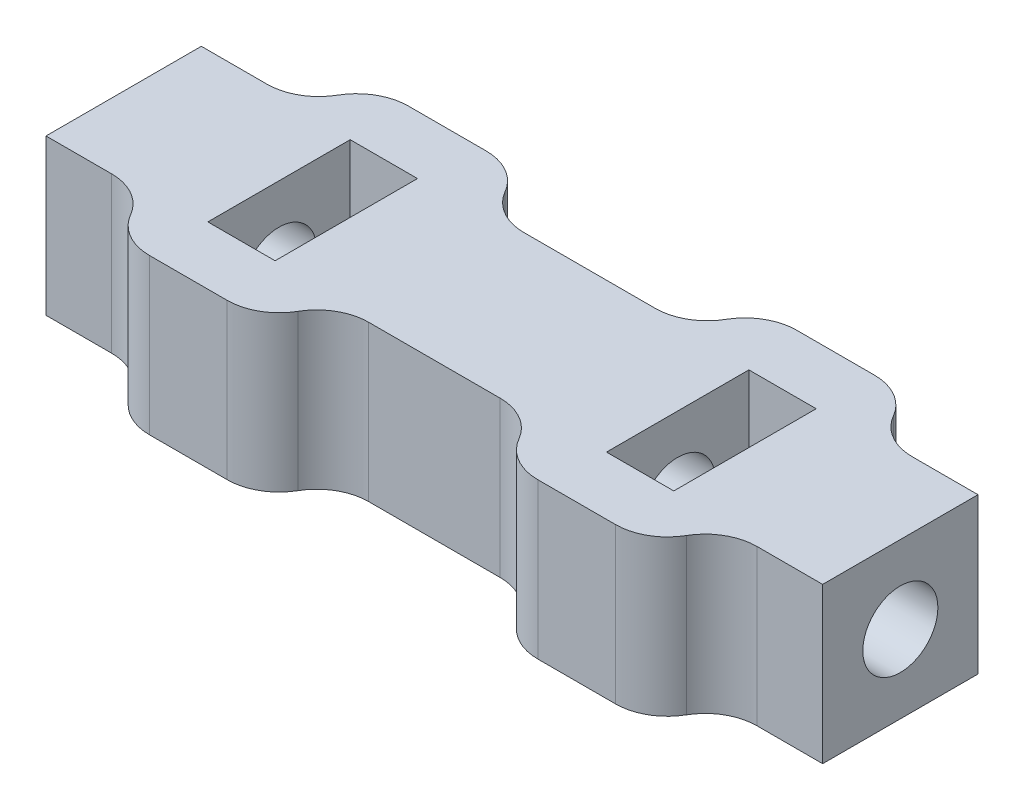
from build123d import *

# Parameters (mm, degrees)
SKETCH1_W           = 30
SKETCH1_H           = 6
BOSS_EXTRUDE1_DEPTH = 6
SKETCH2_R           = 1.45
CUT_EXTRUDE1_DEPTH  = 32.176914536
SKETCH3_W           = 2.6
SKETCH3_H           = 5.5
CUT_EXTRUDE2_DEPTH  = 32.176914536
SKETCH4_W           = 7
SKETCH4_H           = 2
BOSS_EXTRUDE2_DEPTH = 6
FILLET1_R           = 2
FILLET2_R           = 2


with BuildPart() as part:
    # Sketch1 → Boss-Extrude1 (new body)
    with BuildSketch(Plane.XY):
        with Locations((15, -3)):
            Rectangle(SKETCH1_W, SKETCH1_H)
    extrude(amount=BOSS_EXTRUDE1_DEPTH)

    # Sketch2 → Cut-Extrude1 (cut, through all)
    with BuildSketch(Plane(origin=(30, 0, 0), x_dir=(0, 0, -1), z_dir=(1, 0, 0))):
        with Locations((-3, -3)):
            Circle(SKETCH2_R)
    extrude(amount=-CUT_EXTRUDE1_DEPTH, mode=Mode.SUBTRACT)

    # Sketch3 → Cut-Extrude2 (cut, through all)
    with BuildSketch(Plane(origin=(0, 0, 0), x_dir=(1, 0, 0), z_dir=(0, 1, 0))):
        with Locations((7.3, -3)):
            Rectangle(SKETCH3_W, SKETCH3_H)
        with Locations((22.7, -3)):
            Rectangle(SKETCH3_W, SKETCH3_H)
    extrude(amount=-CUT_EXTRUDE2_DEPTH, mode=Mode.SUBTRACT)

    # Sketch4 → Boss-Extrude2 (add)
    with BuildSketch(Plane(origin=(0, 0, 0), x_dir=(1, 0, 0), z_dir=(0, 1, 0))):
        with Locations((7.5, -7)):
            Rectangle(SKETCH4_W, SKETCH4_H)
        with Locations((22.5, -7)):
            Rectangle(SKETCH4_W, SKETCH4_H)
        with Locations((7.5, 1)):
            Rectangle(SKETCH4_W, SKETCH4_H)
        with Locations((22.5, 1)):
            Rectangle(SKETCH4_W, SKETCH4_H)
    extrude(amount=-BOSS_EXTRUDE2_DEPTH)

    # Fillet1
    fillet1_edges = [part.edges().sort_by_distance(p)[0] for p in [
        (26, -3, -2),
        (4, -3, -2),
        (11, -3, -2),
        (19, -3, -2),
        (26, -3, 8),
        (19, -3, 8),
        (11, -3, 8),
        (4, -3, 8),
    ]]
    fillet(fillet1_edges, radius=FILLET1_R - 0.0001)  # a hair under: the kernel refuses the full size

    # Fillet2
    fillet2_edges = [part.edges().sort_by_distance(p)[0] for p in [
        (4, -3, 6),
        (11, -3, 6),
        (19, -3, 6),
        (26, -3, 6),
        (4, -3, 0),
        (11, -3, 0),
        (19, -3, 0),
        (26, -3, 0),
    ]]
    fillet(fillet2_edges, radius=FILLET2_R)


solid = part.part
